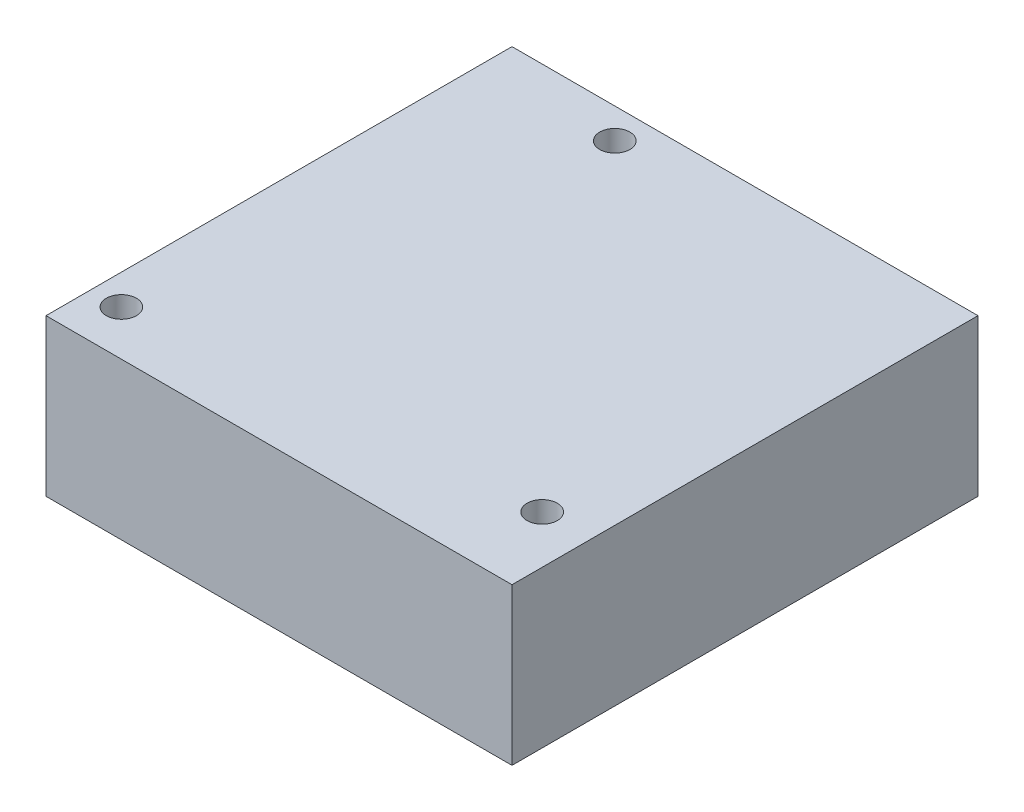
from build123d import *

# Parameters (mm, degrees)
SKETCH1_W            = 43.18
SKETCH1_H            = 43.18
BOSS_EXTRUDE1_DEPTH  = 15
M3_CLEARANCE_HOLE1_D = 2.8
CHAMFER1_SIZE        = 0.5


with BuildPart() as part:
    # Sketch1 → Boss-Extrude1 (new body)
    with BuildSketch(Plane(origin=(0, 0, 0), x_dir=(1, 0, 0), z_dir=(0, 1, 0))):
        Rectangle(SKETCH1_W, SKETCH1_H)
    extrude(amount=BOSS_EXTRUDE1_DEPTH)

    # M3 Clearance Hole1 (through all)
    with Locations(Plane(origin=(0, 15, 0), x_dir=(1, 0, 0), z_dir=(0, 1, 0))):
        with Locations((-18.796, -17.399), (-9.271, 18.796), (17.145, -14.351)):
            Hole(M3_CLEARANCE_HOLE1_D / 2)

    # Chamfer1
    chamfer1_edges = [part.edges().sort_by_distance(p)[0] for p in [
        (0, 0, 21.59),
        (-21.59, 0, 0),
        (21.59, 0, 0),
        (0, 0, -21.59),
    ]]
    chamfer(chamfer1_edges, length=CHAMFER1_SIZE)


solid = part.part
